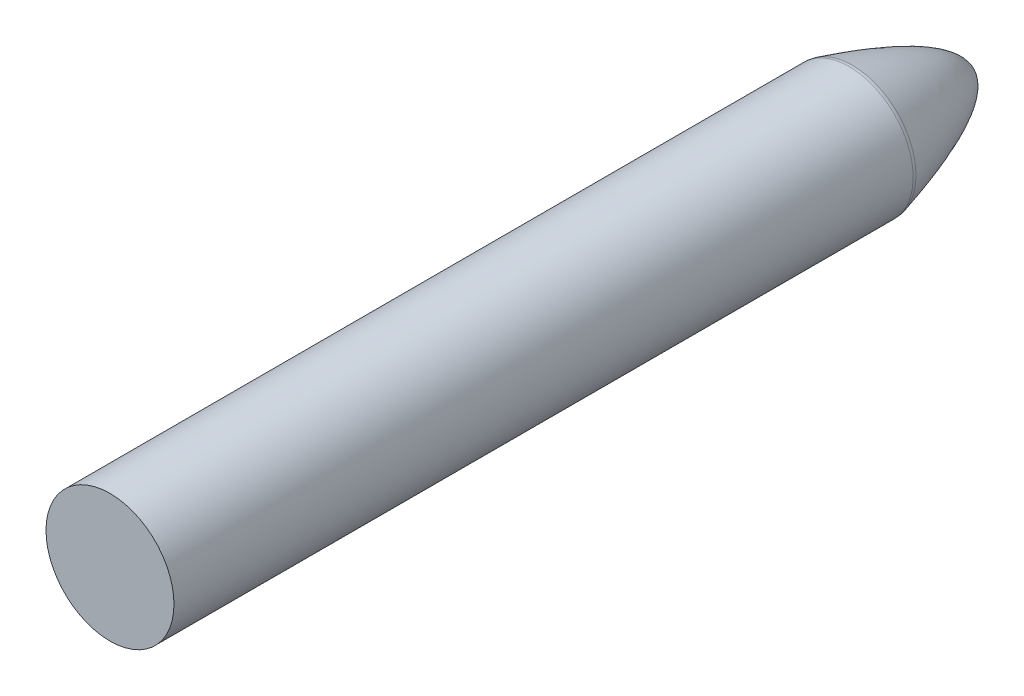
from build123d import *

# Parameters (mm, degrees)
SKETCH10_R          = 1295.369848527
BOSS_EXTRUDE3_DEPTH = 15000
FILLET13_R          = 250


with BuildPart() as part:
    # Sketch9 → Revolve2 (revolve)
    with BuildSketch(Plane(origin=(0, 0, 0), x_dir=(1, 0, 0), z_dir=(0, 1, 0))):
        with BuildLine():
            Line((0, 7000), (-1295.369848527, 7000))
            add(Edge.make_bspline(
                [(-1295.369848527, 7000), (-648.579880215, 9399.031800914), (0, 9400)],
                knots=[0, 0, 0, 0.49979821, 0.49979821, 0.49979821], degree=2))
            Line((0, 9400), (0, 7000))
        make_face()
    revolve(axis=Axis((0, 0, -7000), (0, 0, -1)))

    # Sketch10 → Boss-Extrude3 (add)
    with BuildSketch(Plane.XY.offset(-7000)):
        Circle(SKETCH10_R)
    extrude(amount=BOSS_EXTRUDE3_DEPTH)

    # Fillet13
    fillet13_edges = [part.edges().sort_by_distance(p)[0] for p in [
        (0, -1295.369848527, -7000),
    ]]
    fillet(fillet13_edges, radius=FILLET13_R)


solid = part.part
